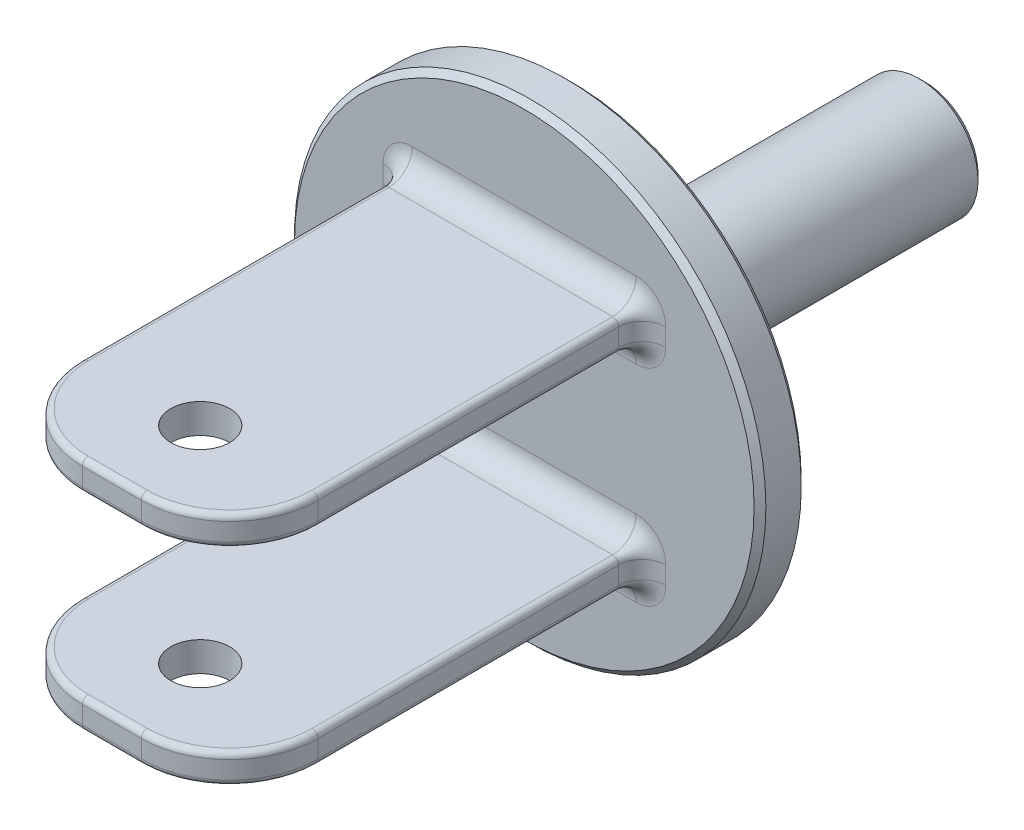
from build123d import *

# Parameters (mm, degrees)
SKETCH1_R            = 40
BOSS_EXTRUDE1_DEPTH  = 8
SKETCH2_W            = 40
SKETCH2_H            = 5
BOSS_EXTRUDE2_DEPTH  = 70
FILLET1_R            = 15
FILLET2_R            = 1
FILLET3_R            = 4
FILLET1_OF_MIRROR1_R = 15
FILLET2_OF_MIRROR1_R = 1
FILLET3_OF_MIRROR1_R = 4
SKETCH3_R            = 5
CUT_EXTRUDE1_DEPTH   = 107.226173799
SKETCH4_R            = 10
SKETCH4_R_2          = 7.5
BOSS_EXTRUDE3_DEPTH  = 60
CHAMFER1_SIZE        = 1
CHAMFER2_SIZE        = 1


with BuildPart() as part:
    # Sketch1 → Boss-Extrude1 (new body)
    with BuildSketch(Plane.XY):
        Circle(SKETCH1_R)
    extrude(amount=BOSS_EXTRUDE1_DEPTH)

    # Sketch2 → Boss-Extrude2 (add)
    with BuildSketch(Plane.XY.offset(8)):
        with Locations((0, 17.5)):
            Rectangle(SKETCH2_W, SKETCH2_H)
    boss_extrude2 = extrude(amount=BOSS_EXTRUDE2_DEPTH)

    # Fillet1
    fillet1_edges = [part.edges().sort_by_distance(p)[0] for p in [
        (20, 17.5, 78),
        (-20, 17.5, 78),
    ]]
    fillet(fillet1_edges, radius=FILLET1_R)

    # Fillet2
    fillet2_edges = [part.edges().sort_by_distance(p)[0] for p in [
        (20, 20, 35.5),
        (15.606601718, 20, 73.606601718),
        (0, 20, 78),
        (-15.606601718, 20, 73.606601718),
        (20, 15, 35.5),
        (15.606601718, 15, 73.606601718),
        (0, 15, 78),
        (-15.606601718, 15, 73.606601718),
        (-20, 20, 35.5),
        (-20, 15, 35.5),
    ]]
    fillet(fillet2_edges, radius=FILLET2_R)

    # Fillet3
    fillet3_edges = [part.edges().sort_by_distance(p)[0] for p in [
        (-19.707106781, 19.707106781, 8),
        (0, 20, 8),
        (19.707106781, 19.707106781, 8),
        (20, 17.5, 8),
        (19.707106781, 15.292893219, 8),
        (0, 15, 8),
        (-19.707106781, 15.292893219, 8),
        (-20, 17.5, 8),
    ]]
    fillet(fillet3_edges, radius=FILLET3_R)

    # Mirror1: Boss-Extrude2 across plane
    add(boss_extrude2.mirror(Plane.ZX))

    # Fillet1 of Mirror1
    fillet1_of_mirror1_edges = [part.edges().sort_by_distance(p)[0] for p in [
        (20, -17.5, 78),
        (-20, -17.5, 78),
    ]]
    fillet(fillet1_of_mirror1_edges, radius=FILLET1_OF_MIRROR1_R)

    # Fillet2 of Mirror1
    fillet2_of_mirror1_edges = [part.edges().sort_by_distance(p)[0] for p in [
        (20, -20, 35.5),
        (15.606601718, -20, 73.606601718),
        (0, -20, 78),
        (-15.606601718, -20, 73.606601718),
        (20, -15, 35.5),
        (15.606601718, -15, 73.606601718),
        (0, -15, 78),
        (-15.606601718, -15, 73.606601718),
        (-20, -20, 35.5),
        (-20, -15, 35.5),
    ]]
    fillet(fillet2_of_mirror1_edges, radius=FILLET2_OF_MIRROR1_R)

    # Fillet3 of Mirror1
    fillet3_of_mirror1_edges = [part.edges().sort_by_distance(p)[0] for p in [
        (-19.707106781, -19.707106781, 8),
        (0, -20, 8),
        (19.707106781, -19.707106781, 8),
        (20, -17.5, 8),
        (19.707106781, -15.292893219, 8),
        (0, -15, 8),
        (-19.707106781, -15.292893219, 8),
        (-20, -17.5, 8),
    ]]
    fillet(fillet3_of_mirror1_edges, radius=FILLET3_OF_MIRROR1_R)

    # Sketch3 → Cut-Extrude1 (cut, through all)
    with BuildSketch(Plane(origin=(0, 20, 0), x_dir=(1, 0, 0), z_dir=(0, 1, 0))):
        with Locations((0, -63)):
            Circle(SKETCH3_R)
    extrude(amount=-CUT_EXTRUDE1_DEPTH, mode=Mode.SUBTRACT)

    # Sketch4 → Boss-Extrude3 (add)
    with BuildSketch(Plane(origin=(0, 0, 0), x_dir=(-1, 0, 0), z_dir=(0, 0, -1))):
        Circle(SKETCH4_R)
        Circle(SKETCH4_R_2, mode=Mode.SUBTRACT)
    extrude(amount=BOSS_EXTRUDE3_DEPTH)

    # Chamfer1
    chamfer1_edges = [part.edges().sort_by_distance(p)[0] for p in [
        (10, 0, -60),
    ]]
    chamfer(chamfer1_edges, length=CHAMFER1_SIZE)

    # Chamfer2
    chamfer2_edges = [part.edges().sort_by_distance(p)[0] for p in [
        (-40, 0, 8),
        (-40, 0, 0),
    ]]
    chamfer(chamfer2_edges, length=CHAMFER2_SIZE)


solid = part.part
